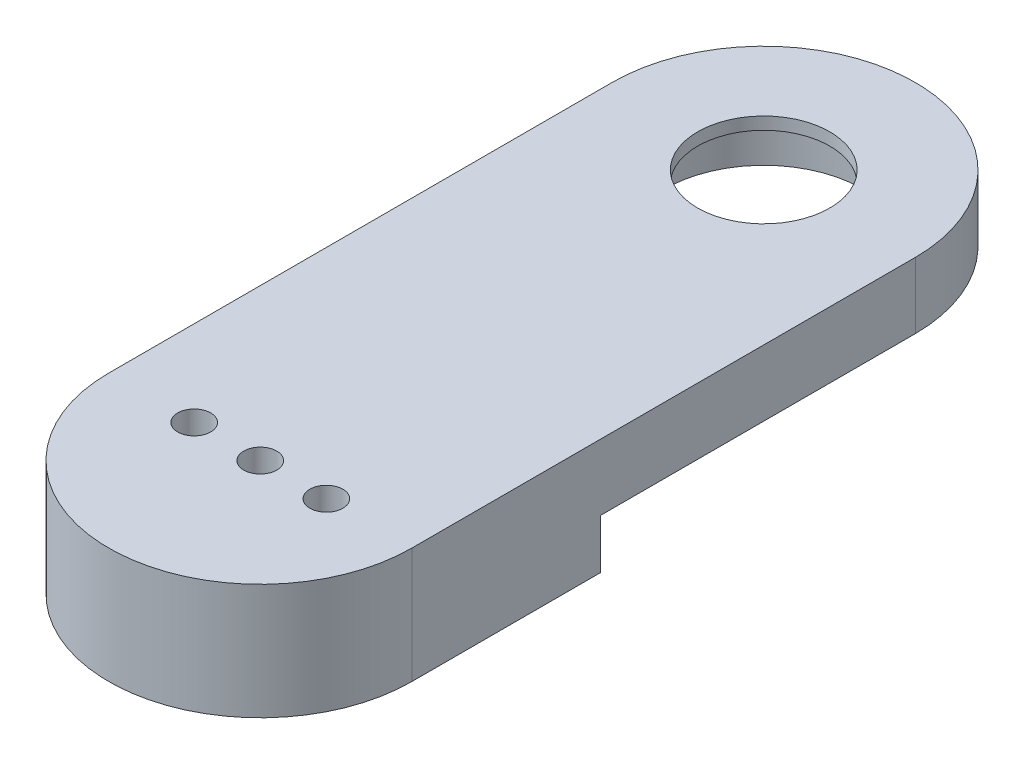
from build123d import *

# Parameters (mm, degrees)
SKETCH1_R           = 12.000000003
SKETCH1_R_2         = 2
BOSS_EXTRUDE1_DEPTH = 14
SKETCH2_R           = 12.000000003
CUT_EXTRUDE1_DEPTH  = 6
BOSS_EXTRUDE2_START = -1.5
SKETCH3_R           = 12.000000003
SKETCH3_R_2         = 8
BOSS_EXTRUDE2_DEPTH = 1.5


with BuildPart() as part:
    # Sketch1 → Boss-Extrude1 (new body)
    with BuildSketch(Plane(origin=(0, 0, 0), x_dir=(1, 0, 0), z_dir=(0, 1, 0))):
        with BuildLine():
            Line((-18.350000003, 0), (-18.350000003, 60.96))
            ThreePointArc((-18.350000003, 60.96), (0, 79.310000003), (18.350000003, 60.96))
            Line((18.350000003, 60.96), (18.350000003, 0))
            ThreePointArc((18.350000003, 0), (0, -18.350000003), (-18.350000003, 0))
        make_face()
        with Locations((0, 60.96)):
            Circle(SKETCH1_R, mode=Mode.SUBTRACT)
        with Locations((-8, 0)):
            Circle(SKETCH1_R_2, mode=Mode.SUBTRACT)
        with Locations((8, 0)):
            Circle(SKETCH1_R_2, mode=Mode.SUBTRACT)
        Circle(SKETCH1_R_2, mode=Mode.SUBTRACT)
    extrude(amount=BOSS_EXTRUDE1_DEPTH)

    # Sketch2 → Cut-Extrude1 (cut)
    with BuildSketch(Plane.XZ):
        with BuildLine():
            Line((-18.350000003, -22.86), (-18.350000003, -60.96))
            ThreePointArc((-18.350000003, -60.96), (0, -79.310000003), (18.350000003, -60.96))
            Line((18.350000003, -60.96), (18.350000003, -22.86))
            Line((18.350000003, -22.86), (-18.350000003, -22.86))
        make_face()
        with Locations((0, -60.96)):
            Circle(SKETCH2_R, mode=Mode.SUBTRACT)
    extrude(amount=-CUT_EXTRUDE1_DEPTH, mode=Mode.SUBTRACT)

    # Sketch3 → Boss-Extrude2 (add)
    with BuildSketch(Plane(origin=(0, 14, 0), x_dir=(1, 0, 0), z_dir=(0, 1, 0)).offset(BOSS_EXTRUDE2_START)):
        with Locations((0, 60.96)):
            Circle(SKETCH3_R)
        with Locations((0, 60.96)):
            Circle(SKETCH3_R_2, mode=Mode.SUBTRACT)
    extrude(amount=BOSS_EXTRUDE2_DEPTH)


solid = part.part
